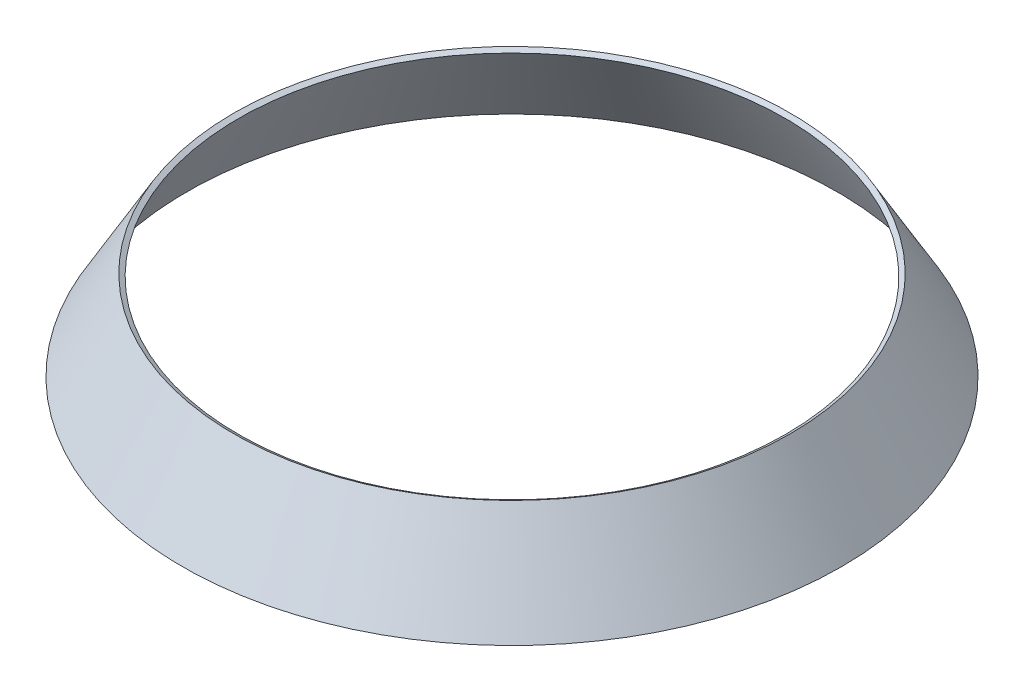
from build123d import *


with BuildPart() as part:
    # Sketch1 → Revolve1 (revolve)
    with BuildSketch(Plane.XY):
        Polygon((37.78, 6.237177826), (44.78, -5.887177826), (44.173782217, -6.237177826), (37.173782217, 5.887177826), align=None)
    revolve(axis=Axis((0, -1106.917829623, 0), (0, 1, 0)))


solid = part.part
